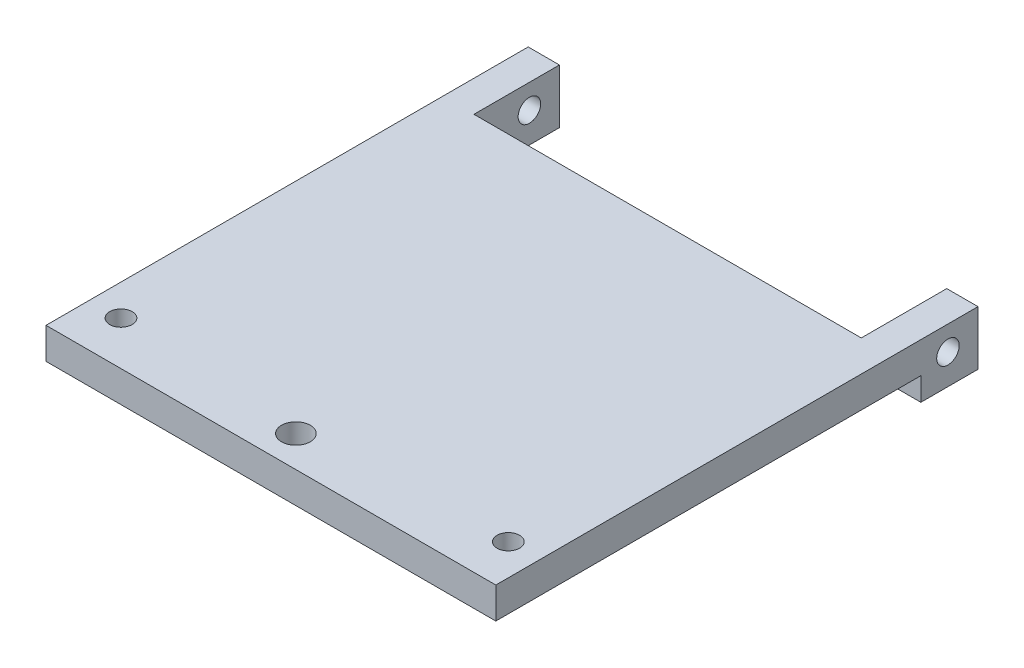
from build123d import *

# Parameters (mm, degrees)
BOSS_EXTRUDE1_DEPTH = 5
SKETCH3_W           = 13.645243265
SKETCH3_H           = 8.694461158
BOSS_EXTRUDE3_DEPTH = 5
SKETCH5_W           = 13.645243265
SKETCH5_H           = 8.694461158
BOSS_EXTRUDE4_DEPTH = 5
SKETCH6_W           = 72
SKETCH6_H           = 5
BOSS_EXTRUDE5_DEPTH = 21
SKETCH8_W           = 114.485355007
SKETCH8_H           = 45.141194617
CUT_EXTRUDE2_DEPTH  = 4.5
SKETCH9_W           = 62
SKETCH9_H           = 5
CUT_EXTRUDE3_DEPTH  = 4.5
SKETCH10_R          = 2.3
SKETCH10_R_2        = 1.8
CUT_EXTRUDE4_DEPTH  = 10
SKETCH11_R          = 1.799999999
CUT_EXTRUDE5_DEPTH  = 90


with BuildPart() as part:
    # Sketch1 → Boss-Extrude1 (new body)
    with BuildSketch(Plane(origin=(0, 0, 0), x_dir=(1, 0, 0), z_dir=(0, 1, 0))):
        Polygon((0, 13), (0, -47), (72, -47), (72, 13.68224698), (67, 13.68224698), (67, 0), (5, 0), (5, 13), align=None)
    extrude(amount=BOSS_EXTRUDE1_DEPTH)

    # Sketch3 → Boss-Extrude3 (add)
    with BuildSketch(Plane(origin=(72, 0, 0), x_dir=(0, 0, -1), z_dir=(1, 0, 0))):
        with Locations((6.859625348, 0.652769421)):
            Rectangle(SKETCH3_W, SKETCH3_H)
    extrude(amount=-BOSS_EXTRUDE3_DEPTH)

    # Sketch5 → Boss-Extrude4 (add)
    with BuildSketch(Plane.ZY):
        with Locations((-6.859625348, 0.652769421)):
            Rectangle(SKETCH5_W, SKETCH5_H)
    extrude(amount=-BOSS_EXTRUDE4_DEPTH)

    # Sketch6 → Boss-Extrude5 (add)
    with BuildSketch(Plane.XY.offset(47)):
        with Locations((36, 2.5)):
            Rectangle(SKETCH6_W, SKETCH6_H)
    extrude(amount=BOSS_EXTRUDE5_DEPTH)

    # Sketch8 → Cut-Extrude2 (cut)
    with BuildSketch(Plane(origin=(0, 0, -13.68224698), x_dir=(-1, 0, 0), z_dir=(0, 0, -1))):
        with Locations((-40.6465034, -1.597733879)):
            Rectangle(SKETCH8_W, SKETCH8_H)
    extrude(amount=-CUT_EXTRUDE2_DEPTH, mode=Mode.SUBTRACT)

    # Sketch9 → Cut-Extrude3 (cut)
    with BuildSketch(Plane(origin=(0, 0, 0), x_dir=(-1, 0, 0), z_dir=(0, 0, -1))):
        with Locations((-36, 2.5)):
            Rectangle(SKETCH9_W, SKETCH9_H)
    extrude(amount=-CUT_EXTRUDE3_DEPTH, mode=Mode.SUBTRACT)

    # Sketch10 → Cut-Extrude4 (cut)
    with BuildSketch(Plane(origin=(0, 0, 0), x_dir=(-1, 0, 0), z_dir=(0, -1, 0))):
        with Locations((-35, -63)):
            Circle(SKETCH10_R)
        with Locations((-67, -61)):
            Circle(SKETCH10_R_2)
        with Locations((-5, -61)):
            Circle(SKETCH10_R_2)
    extrude(amount=-CUT_EXTRUDE4_DEPTH, mode=Mode.SUBTRACT)

    # Sketch11 → Cut-Extrude5 (cut)
    with BuildSketch(Plane(origin=(72, 0, 0), x_dir=(0, 0, -1), z_dir=(1, 0, 0))):
        with Locations((4.375048783, 1.118004887)):
            Circle(SKETCH11_R)
    extrude(amount=-CUT_EXTRUDE5_DEPTH, mode=Mode.SUBTRACT)


solid = part.part
